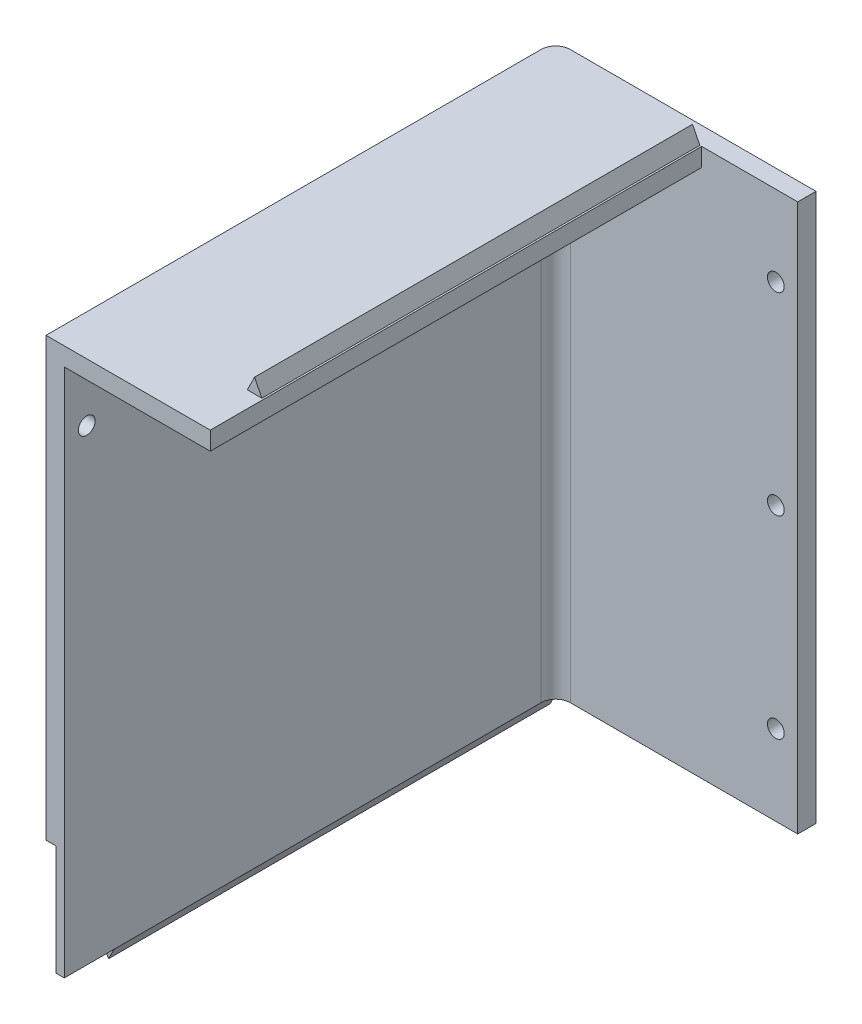
from build123d import *
from OCP.BRepAlgoAPI import BRepAlgoAPI_Cut
from OCP.TopTools import TopTools_ListOfShape

# Parameters (mm, degrees)
BOSS_EXTRUDE1_DEPTH = 75
FILLET1_R           = 2
SKETCH4_W           = 25.830037715
SKETCH4_H           = 76.964783177
CUT_EXTRUDE3_DEPTH  = 10
SKETCH7_W           = 75
SKETCH7_H           = 2.5
BOSS_EXTRUDE2_DEPTH = 7.180004
SKETCH9_W           = 2.5
SKETCH9_H           = 75
BOSS_EXTRUDE3_DEPTH = 20
SKETCH10_W          = 68.5
SKETCH10_H          = 2.5
BOSS_EXTRUDE4_DEPTH = 20
BOSS_EXTRUDE5_START = -67.82
BOSS_EXTRUDE5_DEPTH = 67.82
CUT_EXTRUDE4_DEPTH  = 7.32
SKETCH13_W          = 1.35
SKETCH13_H          = 15.1
CUT_EXTRUDE5_DEPTH  = 7.32
SKETCH15_R          = 1.15
CUT_EXTRUDE6_DEPTH  = 7.32
SKETCH16_R          = 1.15
CUT_EXTRUDE7_DEPTH  = 7.32
BOSS_EXTRUDE8_DEPTH = 59.999996
CHAMFER1_SIZE       = 0.75
CHAMFER2_SIZE       = 0.75


with BuildPart() as part:
    # Sketch1 → Boss-Extrude1 (new body)
    with BuildSketch(Plane(origin=(0, 0, 0), x_dir=(1, 0, 0), z_dir=(0, 1, 0))):
        with BuildLine():
            Line((-20.27294978, -55.394285714), (-17.826119678, -54.881428571))
            ThreePointArc((-17.826119678, -54.881428571), (-18.344064324, -51.565724334), (-18.517328344, -48.214285714))
            Line((-18.517328344, -48.214285714), (-18.517328344, 11.925714286))
            Line((-18.517328344, 11.925714286), (-5.357328344, 11.925714286))
            Line((-5.357328344, 11.925714286), (-5.357328344, 14.425714286))
            Line((-5.357328344, 14.425714286), (-21.017328344, 14.425714286))
            Line((-21.017328344, 14.425714286), (-21.017328344, -48.214285714))
            ThreePointArc((-21.017328344, -48.214285714), (-20.830736323, -51.823527305), (-20.27294978, -55.394285714))
        make_face()
    extrude(amount=BOSS_EXTRUDE1_DEPTH)

    # Fillet1
    fillet1_edges = [part.edges().sort_by_distance(p)[0] for p in [
        (-21.017328344, 37.5, -14.425714286),
        (-18.517328344, 37.5, -11.925714286),
    ]]
    fillet(fillet1_edges, radius=FILLET1_R)

    # Sketch4 → Cut-Extrude3 (cut)
    with BuildSketch(Plane(origin=(-18.517328344, 0, 0), x_dir=(0, 0, -1), z_dir=(1, 0, 0))):
        with Locations((-51.201481413, 38.482391589)):
            Rectangle(SKETCH4_W, SKETCH4_H)
    extrude(amount=CUT_EXTRUDE3_DEPTH, mode=Mode.SUBTRACT)

    # Sketch7 → Boss-Extrude2 (add)
    with BuildSketch(Plane(origin=(0, 0, 48.214285714), x_dir=(0, -1, 0), z_dir=(0, 0, 1))):
        with Locations((-37.5, -19.767328344)):
            Rectangle(SKETCH7_W, SKETCH7_H)
    extrude(amount=BOSS_EXTRUDE2_DEPTH)

    # Sketch9 → Boss-Extrude3 (add)
    with BuildSketch(Plane(origin=(-5.357328344, 0, 0), x_dir=(0, 0, -1), z_dir=(1, 0, 0))):
        with Locations((13.175714286, 37.5)):
            Rectangle(SKETCH9_W, SKETCH9_H)
    extrude(amount=BOSS_EXTRUDE3_DEPTH)

    # Sketch10 → Boss-Extrude4 (add)
    with BuildSketch(Plane(origin=(-18.517328344, 0, 0), x_dir=(0, 0, -1), z_dir=(1, 0, 0))):
        with Locations((-21.144285714, 73.75)):
            Rectangle(SKETCH10_W, SKETCH10_H)
    extrude(amount=BOSS_EXTRUDE4_DEPTH)

    # Sketch11 → Boss-Extrude5 (add)
    with BuildSketch(Plane.XY.offset(55.394285714).offset(BOSS_EXTRUDE5_START)):
        Polygon((-20.767328344, 0), (-18.767328344, 0), (-19.767328344, -2), align=None)
    extrude(amount=BOSS_EXTRUDE5_DEPTH)

    # Sketch12 → Cut-Extrude4 (cut)
    with BuildSketch(Plane.XY.offset(55.394285714)):
        Polygon((-20.767328344, 0), (-18.767328344, 0), (-19.767328344, -2), align=None)
    extrude(amount=-CUT_EXTRUDE4_DEPTH, mode=Mode.SUBTRACT)


with BuildPart() as cut_extrude5_tool:
    # Sketch13 → Cut-Extrude5 (new body)
    with BuildSketch(Plane.XY.offset(55.394285714)):
        with Locations((-20.342328344, 7.55)):
            Rectangle(SKETCH13_W, SKETCH13_H)
    extrude(amount=-CUT_EXTRUDE5_DEPTH)


with BuildPart() as part_1:
    add(part.part)

    # Cut-Extrude5: cut by cut_extrude5_tool, with a tolerance
    cut_extrude5_stock = TopTools_ListOfShape()
    cut_extrude5_stock.Append(part_1.part.wrapped)
    cut_extrude5_tools = TopTools_ListOfShape()
    cut_extrude5_tools.Append(cut_extrude5_tool.part.wrapped)
    cut_extrude5_cut = BRepAlgoAPI_Cut()
    cut_extrude5_cut.SetArguments(cut_extrude5_stock)
    cut_extrude5_cut.SetTools(cut_extrude5_tools)
    cut_extrude5_cut.SetFuzzyValue(0.00001)
    cut_extrude5_cut.Build()
    add(Compound.cast(cut_extrude5_cut.Shape()).solids(), mode=Mode.REPLACE)

    # Sketch15 → Cut-Extrude6 (cut)
    with BuildSketch(Plane(origin=(0, 0, -14.425714286), x_dir=(-1, 0, 0), z_dir=(0, 0, -1))):
        with Locations((-11.642671656, 64)):
            Circle(SKETCH15_R)
        with Locations((-11.642671656, 37.5)):
            Circle(SKETCH15_R)
        with Locations((-11.642671656, 11)):
            Circle(SKETCH15_R)
    extrude(amount=-CUT_EXTRUDE6_DEPTH, mode=Mode.SUBTRACT)

    # Sketch16 → Cut-Extrude7 (cut)
    with BuildSketch(Plane.ZY.offset(21.017328344)):
        with Locations((52.314285714, 64)):
            Circle(SKETCH16_R)
    extrude(amount=-CUT_EXTRUDE7_DEPTH, mode=Mode.SUBTRACT)

    # Sketch14 → Boss-Extrude8 (add)
    with BuildSketch(Plane.XY.offset(48.074285714)):
        Polygon((1.232671656, 75), (-0.767328344, 75), (0.232671656, 77), align=None)
    extrude(amount=-BOSS_EXTRUDE8_DEPTH)

    # Chamfer1
    chamfer1_edges = [part_1.edges().sort_by_distance(p)[0] for p in [
        (-21.017328344, 64, 51.164285714),
    ]]
    chamfer(chamfer1_edges, length=CHAMFER1_SIZE)

    # Chamfer2
    chamfer2_edges = [part_1.edges().sort_by_distance(p)[0] for p in [
        (12.792671656, 64, -14.425714286),
        (12.792671656, 37.5, -14.425714286),
        (12.792671656, 11, -14.425714286),
    ]]
    chamfer(chamfer2_edges, length=CHAMFER2_SIZE)


solid = part_1.part
